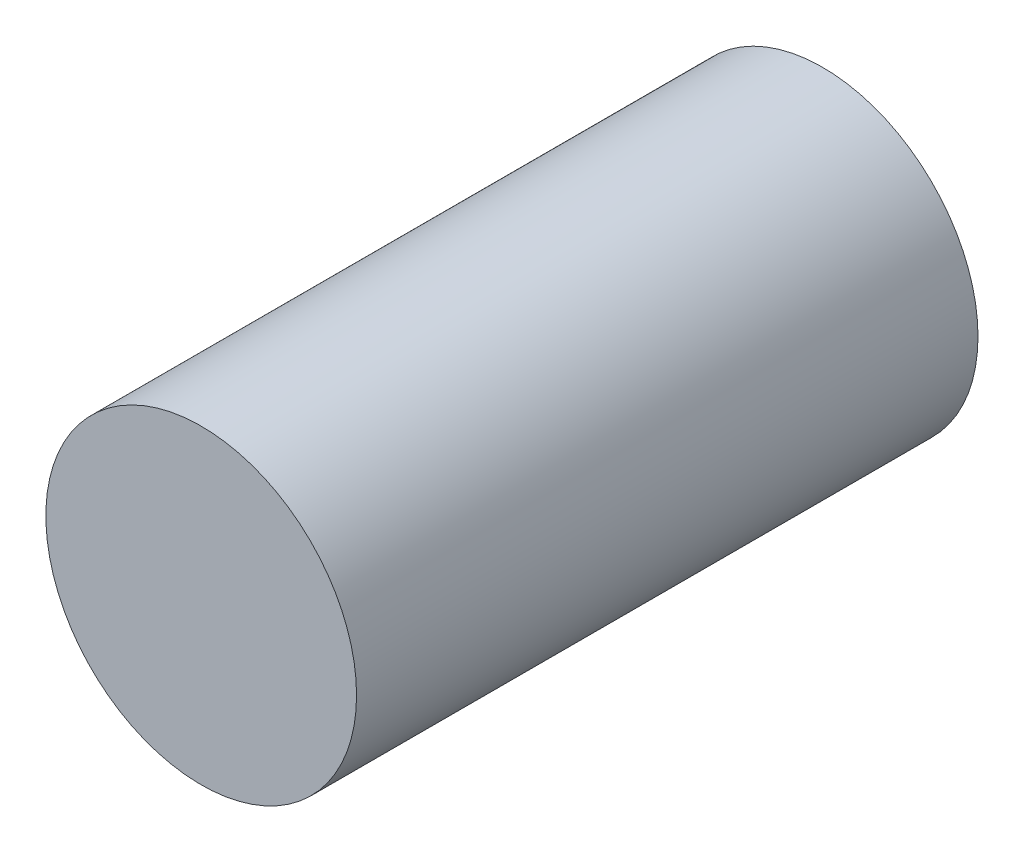
from build123d import *

# Parameters (mm, degrees)
SKETCH1_R           = 0.25
BOSS_EXTRUDE1_DEPTH = 1


with BuildPart() as part:
    # Sketch1 → Boss-Extrude1 (new body)
    with BuildSketch(Plane.XY):
        Circle(SKETCH1_R)
    extrude(amount=BOSS_EXTRUDE1_DEPTH)


solid = part.part
